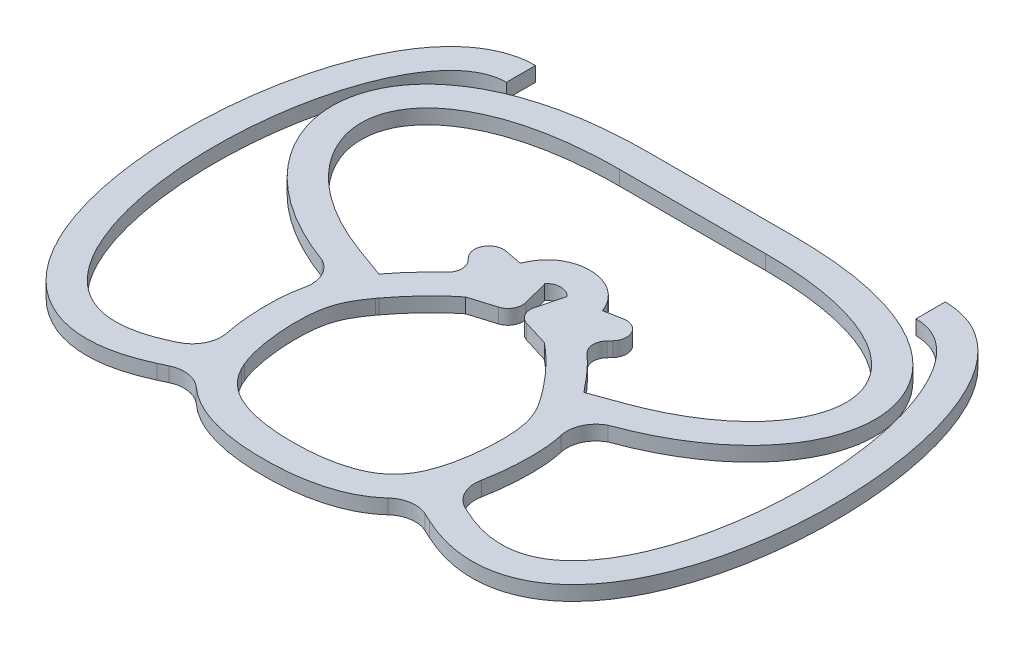
from build123d import *

# Parameters (mm, degrees)
BOSS_EXTRUDE1_DEPTH = 5
BOSS_EXTRUDE2_DEPTH = 5
BOSS_EXTRUDE3_DEPTH = 5
FILLET1_DEPTH       = 5
FILLET2_R           = 5
BOSS_EXTRUDE4_DEPTH = 5


with BuildPart() as part:
    # Boss-Extrude1: read off the stored shape, not the designer's step
    # Boss-Extrude1 outline → Boss-Extrude1 (new body)
    with BuildSketch(Plane(origin=(0, 0, 0), x_dir=(1, 0, 0), z_dir=(0, 1, 0))):
        with BuildLine():
            add(Edge.make_bspline(
                [(0.269234602, 62.496374979), (-0.316087257, 62.512110106), (-1.495200489, 62.483301542), (-4.072157241, 62.112319122), (-7.548392551, 60.868039632), (-10.685810389, 58.329274395), (-12.31940922, 56.135044261), (-13.089141374, 54.822098669), (-13.753794872, 53.469071862), (-14.31136697, 51.98349697), (-14.918160712, 49.9148359), (-15.293453989, 48.203013216), (-15.602712289, 46.812150643), (-15.80676239, 45.962959824), (-15.982897975, 45.346055495), (-16.129857041, 44.935667734), (-16.339428407, 44.495707249), (-16.672677613, 43.986417882), (-17.211526595, 43.341595222), (-18.317216892, 42.246512187), (-20.085747665, 40.779114315), (-22.405982769, 38.865411209), (-24.997404593, 36.573844191), (-28.033743964, 33.559213097), (-31.460823378, 29.771438769), (-34.051795785, 26.626443053), (-35.932186475, 24.189674876), (-37.666585446, 21.839101841), (-39.695202514, 18.836502931), (-41.832087069, 14.87868562), (-43.489639336, 10.485012642), (-44.540740201, 5.768596303), (-45.045155682, 0.790601338), (-45.134946864, -4.677002278), (-44.811021925, -10.590075496), (-44.022511798, -16.718832254), (-42.679540884, -22.870474943), (-40.988337321, -27.856535841), (-39.08200473, -31.755940971), (-36.84353087, -35.351194932), (-33.528747086, -39.185560371), (-29.044929345, -42.660814548), (-24.429236334, -45.113098867), (-19.928871582, -46.768387952), (-15.740178441, -47.872382359), (-11.61331918, -48.64078475), (-7.603529847, -49.107382953), (-3.709689612, -49.339608846), (0.016862286, -49.395042343), (3.718435598, -49.330173403), (7.549027938, -49.095631398), (11.465081701, -48.643200371), (15.482777155, -47.913880735), (19.534013423, -46.89244002), (23.957103217, -45.358536833), (28.565088179, -43.035788447), (33.096772184, -39.67221788), (36.47896786, -35.892297618), (38.768870741, -32.332183545), (40.746955114, -28.416318654), (42.499322681, -23.368216018), (43.900235041, -17.121534112), (44.740613754, -10.871468665), (45.108509614, -4.834588503), (45.05162847, 0.742666238), (44.563424436, 5.798098176), (43.50893989, 10.568516038), (41.826726038, 14.991072116), (39.664044725, 18.936380313), (37.632268601, 21.900289529), (35.909411571, 24.213021291), (34.04045592, 26.619894089), (31.463840663, 29.739497828), (28.052364634, 33.514985967), (25.025316473, 36.535088285), (22.44311727, 38.839026827), (20.119182356, 40.77853755), (18.321620447, 42.285806958), (17.181063319, 43.418878203), (16.626892706, 44.081428387), (16.301455506, 44.578846532), (16.118401906, 44.966700784), (15.99839947, 45.301868681), (15.84104306, 45.860370316), (15.654899287, 46.657418165), (15.368509548, 47.991844022), (15.014661816, 49.672682174), (14.421442434, 51.735703008), (13.769222487, 53.508941133), (12.67465549, 55.608697131), (10.789303172, 58.133131632), (7.758530397, 60.612442527), (4.497178162, 61.905060453), (2.016730666, 62.388890781), (0.854556461, 62.480639853), (0.269234602, 62.496374979)],
                knots=[0, 0, 0, 0, 0.00390625, 0.0078125, 0.015625, 0.0234375, 0.02734375, 0.029296875, 0.03125, 0.03515625, 0.0390625, 0.046875, 0.05078125, 0.0546875, 0.05859375, 0.0625, 0.0703125, 0.078125, 0.0859375, 0.09375, 0.109375, 0.1171875, 0.125, 0.140625, 0.15625, 0.171875, 0.1796875, 0.1875, 0.203125, 0.21875, 0.234375, 0.25, 0.265625, 0.28125, 0.296875, 0.3125, 0.328125, 0.34375, 0.3515625, 0.359375, 0.375, 0.390625, 0.40625, 0.421875, 0.4375, 0.453125, 0.46875, 0.484375, 0.5, 0.515625, 0.53125, 0.546875, 0.5625, 0.578125, 0.59375, 0.609375, 0.625, 0.640625, 0.6484375, 0.65625, 0.671875, 0.6875, 0.703125, 0.71875, 0.734375, 0.75, 0.765625, 0.78125, 0.796875, 0.8125, 0.8203125, 0.828125, 0.84375, 0.859375, 0.875, 0.8828125, 0.890625, 0.90625, 0.9140625, 0.921875, 0.9296875, 0.9375, 0.94140625, 0.9453125, 0.94921875, 0.953125, 0.9609375, 0.96484375, 0.96875, 0.97265625, 0.9765625, 0.984375, 0.9921875, 0.99609375, 1, 1, 1, 1], degree=3))
        make_face()
        with BuildLine():
            add(Edge.make_bspline(
                [(0, 52.5), (-1.721071682, 52.546354008), (-5.023998095, 51.233565024), (-6.323060915, 37.961902054), (-16.72278471, 31.741990575), (-31.117683568, 14.955497586), (-36.553974343, 3.663736091), (-33.187275504, -30.146909076), (-15.980150699, -38.594852737), (0.139720776, -39.754618009), (15.891625076, -38.533398343), (33.010071371, -30.567020646), (36.583768429, 3.98657687), (31.092499601, 14.934506796), (16.757167605, 31.680356213), (6.162520537, 38.211789736), (5.189811126, 51.006110328), (1.662583855, 52.455221257), (0, 52.5)],
                knots=[0, 0, 0, 0, 0.03031502, 0.060187434, 0.120481774, 0.182983676, 0.266134617, 0.349103446, 0.429415993, 0.5, 0.571597832, 0.652658902, 0.733865383, 0.817016324, 0.879518226, 0.939812566, 0.970715187, 1, 1, 1, 1], degree=3))
        make_face(mode=Mode.SUBTRACT)
    extrude(amount=BOSS_EXTRUDE1_DEPTH)

    # Sketch11 → Boss-Extrude2 (add)
    with BuildSketch(Plane(origin=(0, 0, 0), x_dir=(1, 0, 0), z_dir=(0, 1, 0))):
        Polygon((46.638064432, -39.23390417), (50.864247049, -30.1708263), (32.738091309, -21.718461065), (28.511908691, -30.781538935), align=None)
        Polygon((25.313437643, 21.683823155), (45.521251699, 29.03886597), (48.941453132, 19.641939763), (31.561562357, 13.316176845), align=None)
        Polygon((-45.521251699, 29.03886597), (-48.941453132, 19.641939763), (-31.561562357, 13.316176845), (-25.313437643, 21.683823155), align=None)
        Polygon((-50.864247049, -30.1708263), (-32.738091309, -21.718461065), (-28.511908691, -30.781538935), (-46.638064432, -39.23390417), align=None)
    extrude(amount=BOSS_EXTRUDE2_DEPTH)

    # Sketch12 → Boss-Extrude3 (add)
    with BuildSketch(Plane(origin=(0, 0, 0), x_dir=(1, 0, 0), z_dir=(0, 1, 0))):
        Polygon((34.881163395, 56.58020961), (3.802445815, 50.739549237), (0.25, 37.321793732), (13.522585556, 33.260450763), align=None)
        Polygon((-0.25, 37.321793732), (-13.522585556, 33.260450763), (-34.881163395, 56.58020961), (-3.802445815, 50.739549237), align=None)
    extrude(amount=BOSS_EXTRUDE3_DEPTH)

    # Fillet1: read off the stored shape, not the designer's step
    # Fillet1 outline → Fillet1 (add)
    with BuildSketch(Plane(origin=(0, 0, 0), x_dir=(1, 0, 0), z_dir=(0, 1, 0))):
        with BuildLine():
            add(Edge.make_bspline(
                [(43.925438372, 8.545754095), (43.769758642, 9.210433612), (43.184227387, 11.422188271), (42.141685538, 14.163040621), (41.169508533, 16.118829323), (40.860739482, 16.700800523)],
                knots=[0.759048135, 0.759048135, 0.759048135, 0.759048135, 0.765625, 0.78125, 0.788098633, 0.788098633, 0.788098633, 0.788098633], degree=3))
            ThreePointArc((43.925438372, 8.545754095), (44.54972527, 14.945380062), (48.941453132, 19.641939763))
            Line((48.941453132, 19.641939763), (40.860739482, 16.700800523))
        make_face()
        with BuildLine():
            ThreePointArc((49.155037803, -29.373808939), (44.463533889, -24.835647301), (43.571421025, -18.369639672))
            add(Edge.make_bspline(
                [(41.59747588, -25.849659957), (41.882351881, -25.017772986), (42.647949945, -22.549456462), (43.241904814, -20.034933705), (43.571421025, -18.369639672)],
                knots=[0.66545057, 0.66545057, 0.66545057, 0.66545057, 0.671875, 0.684376727, 0.684376727, 0.684376727, 0.684376727], degree=3))
            Line((41.59747588, -25.849659957), (49.155037803, -29.373808939))
        make_face()
        with BuildLine():
            add(Edge.make_bspline(
                [(32.891440554, -39.592453868), (32.933670957, -39.55408076), (34.409872804, -38.204705023), (35.844455306, -36.601424792), (37.091917422, -34.852624533), (37.129280852, -34.799885567)],
                knots=[0.62454059, 0.62454059, 0.62454059, 0.62454059, 0.625, 0.640625, 0.641109229, 0.641109229, 0.641109229, 0.641109229], degree=3))
            ThreePointArc((32.891440554, -39.592453868), (38.115878282, -37.106662161), (43.842607692, -37.930361284))
            Line((43.842607692, -37.930361284), (37.129280852, -34.799885567))
        make_face()
        with BuildLine():
            ThreePointArc((-43.784195306, -37.903123141), (-38.071102457, -37.077363973), (-32.853467548, -39.546694662))
            add(Edge.make_bspline(
                [(-37.101386413, -34.786878176), (-35.982913937, -36.345133568), (-34.565196391, -37.962501758), (-33.051954193, -39.367334661), (-32.853467548, -39.546694662)],
                knots=[0.360536898, 0.360536898, 0.360536898, 0.360536898, 0.375, 0.377165089, 0.377165089, 0.377165089, 0.377165089], degree=3))
            Line((-37.101386413, -34.786878176), (-43.784195306, -37.903123141))
        make_face()
        with BuildLine():
            add(Edge.make_bspline(
                [(-43.621193578, -18.383298029), (-43.324375508, -19.876354021), (-42.735300393, -22.390906943), (-41.972894909, -24.862947557), (-41.624834901, -25.862417658)],
                knots=[0.316725344, 0.316725344, 0.316725344, 0.316725344, 0.328125, 0.335957197, 0.335957197, 0.335957197, 0.335957197], degree=3))
            ThreePointArc((-43.621193578, -18.383298029), (-44.509556929, -24.85407359), (-49.203076422, -29.396209715))
            Line((-49.203076422, -29.396209715), (-41.624834901, -25.862417658))
        make_face()
        with BuildLine():
            ThreePointArc((-48.941453132, 19.641939763), (-44.522419918, 14.935465763), (-43.90008978, 8.509622841))
            add(Edge.make_bspline(
                [(-40.828112994, 16.688925457), (-41.151183163, 16.075896479), (-42.129498225, 14.090338013), (-43.166911151, 11.340468083), (-43.74658636, 9.158971114), (-43.90008978, 8.509622841)],
                knots=[0.211535684, 0.211535684, 0.211535684, 0.211535684, 0.21875, 0.234375, 0.240873359, 0.240873359, 0.240873359, 0.240873359], degree=3))
            Line((-40.828112994, 16.688925457), (-48.941453132, 19.641939763))
        make_face()
    extrude(amount=FILLET1_DEPTH)

    # Fillet2
    fillet2_edges = [part.edges().sort_by_distance(p)[0] for p in [
        (-34.881163395, 2.5, -56.58020961),
        (34.881163395, 2.5, -56.58020961),
        (20.283846663, 2.5, -40.642542385),
        (-20.270727233, 2.5, -40.628218307),
        (0.25, 2.5, -37.321793732),
        (-0.25, 2.5, -37.321793732),
    ]]
    fillet(fillet2_edges, radius=FILLET2_R)

    # Sketch13 → Boss-Extrude4 (add)
    with BuildSketch(Plane(origin=(0, 0, 0), x_dir=(1, 0, 0), z_dir=(0, 1, 0))):
        with BuildLine():
            Line((-48.941453132, 19.641939763), (-45.521251699, 29.03886597))
            add(Edge.make_bspline(
                [(-45.521251699, 29.03886597), (-46.367991442, 29.347054033), (-48.0673649, 29.992174254), (-51.315397014, 31.33102828), (-55.171677289, 33.118917933), (-59.444565381, 35.418933919), (-64.673400405, 38.668785714), (-70.319437225, 43.023236508), (-75.65354417, 48.552176161), (-79.543934251, 54.212739548), (-82.83169021, 61.720717285), (-83.404104567, 68.850221919), (-81.438994987, 75.487474512), (-78.592924883, 80.272664352), (-74.208209606, 84.810439409), (-68.126080119, 88.954034658), (-61.557274972, 91.915293893), (-55.373288473, 93.890482041), (-50.266362752, 95.151592143), (-44.686854312, 96.169792129), (-39.639995994, 96.797810986), (-35.36453492, 97.157514289), (-32.033977768, 97.353404687), (-28.597997497, 97.472904025), (-26.189595766, 97.5), (-25, 97.5)],
                knots=[0, 0, 0, 0, 0.015625, 0.03125, 0.0625, 0.09375, 0.125, 0.1875, 0.25, 0.3125, 0.375, 0.5, 0.5625, 0.625, 0.6875, 0.75, 0.8125, 0.84375, 0.875, 0.90625, 0.9375, 0.953125, 0.96875, 0.984375, 1, 1, 1, 1], degree=3))
            Line((-25, 97.5), (25, 97.5))
            add(Edge.make_bspline(
                [(25, 97.5), (26.189595766, 97.5), (28.597997497, 97.472904025), (32.033977768, 97.353404687), (35.36453492, 97.157514289), (39.639995994, 96.797810986), (44.686854312, 96.169792129), (50.266362752, 95.151592143), (55.373288473, 93.890482041), (61.557274972, 91.915293893), (68.126080119, 88.954034658), (74.208209606, 84.810439409), (78.592924883, 80.272664352), (81.438994987, 75.487474512), (83.404104567, 68.850221919), (82.83169021, 61.720717285), (79.543934251, 54.212739548), (75.65354417, 48.552176161), (70.319437225, 43.023236508), (64.673400405, 38.668785714), (59.444565381, 35.418933919), (55.171677289, 33.118917933), (51.315397014, 31.33102828), (48.0673649, 29.992174254), (46.367991442, 29.347054033), (45.521251699, 29.03886597)],
                knots=[0, 0, 0, 0, 0.015625, 0.03125, 0.046875, 0.0625, 0.09375, 0.125, 0.15625, 0.1875, 0.25, 0.3125, 0.375, 0.4375, 0.5, 0.625, 0.6875, 0.75, 0.8125, 0.875, 0.90625, 0.9375, 0.96875, 0.984375, 1, 1, 1, 1], degree=3))
            Line((45.521251699, 29.03886597), (48.941453132, 19.641939763))
            add(Edge.make_bspline(
                [(25, 107.5), (26.265662521, 107.5), (28.823871746, 107.47123367), (33.723283065, 107.301093204), (39.592231007, 106.881827628), (46.184897663, 106.062251974), (54.398719277, 104.565292282), (63.59025186, 101.968037299), (72.933467248, 97.779669738), (80.595354168, 92.593764827), (88.525862634, 84.460913371), (92.804143212, 74.711399267), (93.168791144, 64.407288657), (91.589592301, 56.709652915), (88.286843995, 49.240083527), (83.381846013, 42.134988372), (76.961585868, 35.500909754), (70.4006784, 30.451403214), (64.448419887, 26.753431439), (59.638985842, 24.165656039), (55.342365739, 22.1742434), (51.745601615, 20.691830029), (49.874903192, 19.981687799), (48.941453132, 19.641939763)],
                knots=[0, 0, 0, 0, 0.015625, 0.03125, 0.0625, 0.09375, 0.125, 0.1875, 0.25, 0.3125, 0.375, 0.5, 0.5625, 0.625, 0.6875, 0.75, 0.8125, 0.875, 0.90625, 0.9375, 0.96875, 0.984375, 1, 1, 1, 1], degree=3))
            Line((25, 107.5), (-25, 107.5))
            add(Edge.make_bspline(
                [(-48.941453132, 19.641939763), (-49.874903192, 19.981687799), (-51.745601615, 20.691830029), (-55.342365739, 22.1742434), (-59.638985842, 24.165656039), (-64.448419887, 26.753431439), (-70.4006784, 30.451403214), (-76.961585868, 35.500909754), (-83.381846013, 42.134988372), (-88.286843995, 49.240083527), (-91.589592301, 56.709652915), (-93.168791144, 64.407288657), (-92.804143212, 74.711399267), (-88.525862634, 84.460913371), (-80.595354168, 92.593764827), (-72.933467248, 97.779669738), (-63.59025186, 101.968037299), (-54.398719277, 104.565292282), (-46.184897663, 106.062251974), (-39.592231007, 106.881827628), (-33.723283065, 107.301093204), (-28.823871746, 107.47123367), (-26.265662521, 107.5), (-25, 107.5)],
                knots=[0, 0, 0, 0, 0.015625, 0.03125, 0.0625, 0.09375, 0.125, 0.1875, 0.25, 0.3125, 0.375, 0.4375, 0.5, 0.625, 0.6875, 0.75, 0.8125, 0.875, 0.90625, 0.9375, 0.96875, 0.984375, 1, 1, 1, 1], degree=3))
        make_face()
        with BuildLine():
            Line((-50.864247049, -30.1708263), (-46.638064432, -39.23390417))
            add(Edge.make_bspline(
                [(-46.638064432, -39.23390417), (-47.244378799, -39.516633202), (-48.47658035, -40.067746464), (-50.890277185, -41.05289239), (-53.872647335, -42.093694067), (-57.378406652, -43.031467353), (-61.96053225, -43.872250809), (-67.505167242, -44.156437073), (-73.803411181, -43.291125647), (-79.646864998, -41.285636943), (-86.722454928, -37.251954512), (-94.129358586, -30.040987332), (-100.921645515, -18.870922031), (-107.565830938, -1.429471676), (-111.769685131, 23.86442829), (-111.009732856, 50.354345929), (-107.527710703, 70.146952553), (-103.474454182, 83.775520804), (-97.930774228, 95.68324587), (-91.937640711, 103.758112672), (-86.157999912, 108.764443443), (-81.298699663, 111.651085443), (-76.824933341, 113.188703174), (-73.058452737, 113.818001354), (-71.105901767, 113.924453123), (-70.136129705, 113.924453123)],
                knots=[0, 0, 0, 0, 0.0078125, 0.015625, 0.03125, 0.046875, 0.0625, 0.09375, 0.125, 0.15625, 0.1875, 0.25, 0.3125, 0.375, 0.5, 0.625, 0.6875, 0.75, 0.8125, 0.875, 0.90625, 0.9375, 0.96875, 0.984375, 1, 1, 1, 1], degree=3))
            Line((-70.136129705, 113.924453123), (-70.136129705, 103.924453123))
            add(Edge.make_bspline(
                [(-50.864247049, -30.1708263), (-51.373559006, -30.408322365), (-52.413431329, -30.873377388), (-54.411936296, -31.688661094), (-56.833745982, -32.532558009), (-59.593596412, -33.268975779), (-63.089534426, -33.907971789), (-67.120293031, -34.103842921), (-71.4870464, -33.497106447), (-75.490355793, -32.124487729), (-80.463474501, -29.302477954), (-86.111222548, -23.890497321), (-91.83789466, -14.566135066), (-96.28742417, -2.945255688), (-99.36244029, 10.350355756), (-101.589144354, 29.477703795), (-100.871007361, 54.472573935), (-95.679888914, 76.853607876), (-89.198153589, 90.680440188), (-84.370264526, 97.085719282), (-80.231206757, 100.643813711), (-77.032373342, 102.528239265), (-74.268901423, 103.471044192), (-71.964779276, 103.857636223), (-70.740557452, 103.924453123), (-70.136129705, 103.924453123)],
                knots=[0, 0, 0, 0, 0.0078125, 0.015625, 0.03125, 0.046875, 0.0625, 0.09375, 0.125, 0.15625, 0.1875, 0.25, 0.3125, 0.375, 0.4375, 0.5, 0.625, 0.75, 0.8125, 0.875, 0.90625, 0.9375, 0.96875, 0.984375, 1, 1, 1, 1], degree=3))
        make_face()
        with BuildLine():
            Line((46.638064432, -39.23390417), (50.864247049, -30.1708263))
            add(Edge.make_bspline(
                [(70.136129705, 103.924453123), (70.740557452, 103.924453123), (71.964779276, 103.857636223), (74.268901423, 103.471044192), (77.032373342, 102.528239265), (80.231206757, 100.643813711), (84.370264526, 97.085719282), (89.198153589, 90.680440188), (95.679888914, 76.853607876), (100.871007361, 54.472573935), (101.589144354, 29.477703795), (99.36244029, 10.350355756), (96.28742417, -2.945255688), (91.83789466, -14.566135066), (86.111222548, -23.890497321), (80.463474501, -29.302477954), (75.490355793, -32.124487729), (71.4870464, -33.497106447), (67.120293031, -34.103842921), (63.089534426, -33.907971789), (59.593596412, -33.268975779), (56.833745982, -32.532558009), (54.411936296, -31.688661094), (52.413431329, -30.873377388), (51.373559006, -30.408322365), (50.864247049, -30.1708263)],
                knots=[0, 0, 0, 0, 0.015625, 0.03125, 0.0625, 0.09375, 0.125, 0.1875, 0.25, 0.375, 0.5, 0.5625, 0.625, 0.6875, 0.75, 0.8125, 0.84375, 0.875, 0.90625, 0.9375, 0.953125, 0.96875, 0.984375, 0.9921875, 1, 1, 1, 1], degree=3))
            Line((70.136129705, 103.924453123), (70.136129705, 113.924453123))
            add(Edge.make_bspline(
                [(70.136129705, 113.924453123), (71.105901767, 113.924453123), (73.058452737, 113.818001354), (76.824933341, 113.188703174), (81.298699663, 111.651085443), (86.157999912, 108.764443443), (91.937640711, 103.758112672), (97.930774228, 95.68324587), (103.474454182, 83.775520804), (107.527710703, 70.146952553), (111.009732856, 50.354345929), (111.769685131, 23.86442829), (107.565830938, -1.429471676), (100.921645515, -18.870922031), (94.129358586, -30.040987332), (86.722454928, -37.251954512), (79.646864998, -41.285636943), (73.803411181, -43.291125647), (67.505167242, -44.156437073), (61.96053225, -43.872250809), (57.378406652, -43.031467353), (53.872647335, -42.093694067), (50.890277185, -41.05289239), (48.47658035, -40.067746464), (47.244378799, -39.516633202), (46.638064432, -39.23390417)],
                knots=[0, 0, 0, 0, 0.015625, 0.03125, 0.0625, 0.09375, 0.125, 0.1875, 0.25, 0.3125, 0.375, 0.5, 0.625, 0.6875, 0.75, 0.8125, 0.84375, 0.875, 0.90625, 0.9375, 0.953125, 0.96875, 0.984375, 0.9921875, 1, 1, 1, 1], degree=3))
        make_face()
    extrude(amount=BOSS_EXTRUDE4_DEPTH)


solid = part.part
